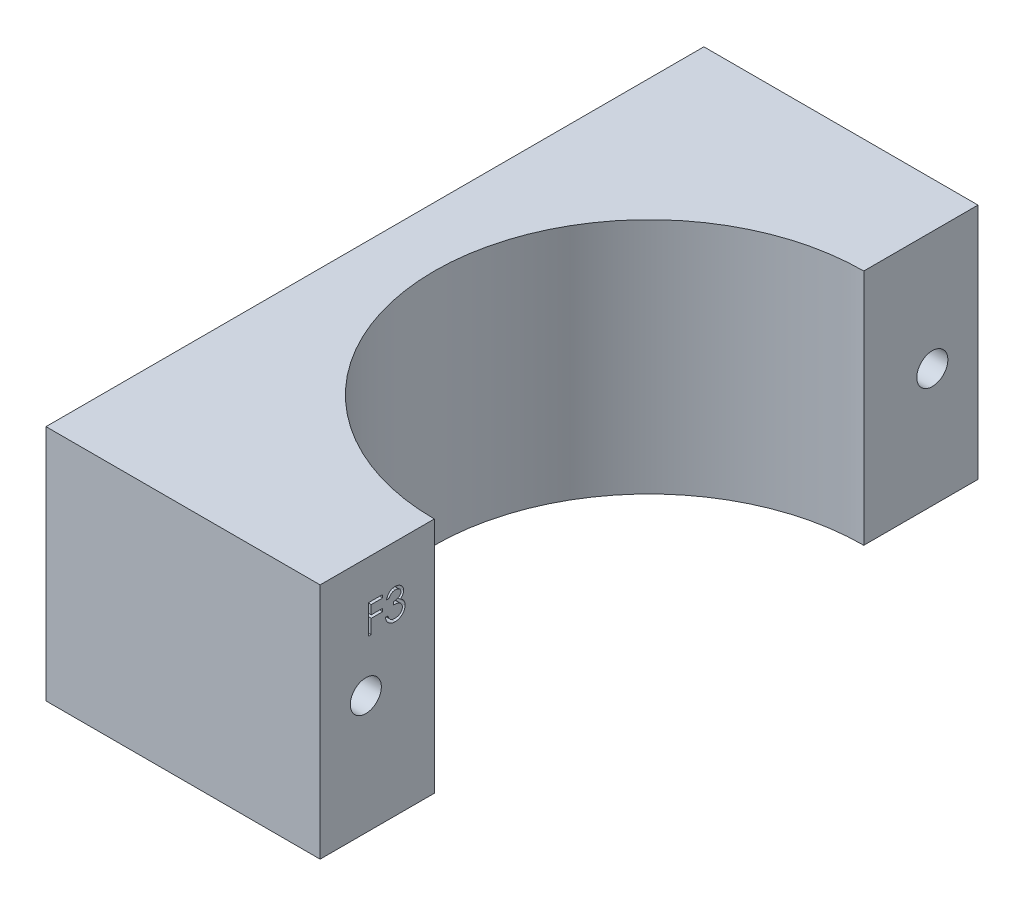
from build123d import *

# Parameters (mm, degrees)
BOSS_EXTRUDE1_DEPTH = 26
SKETCH2_R           = 1.7
CUT_EXTRUDE1_DEPTH  = 56.982083504
CUT_EXTRUDE2_DEPTH  = 1


with BuildPart() as part:
    # Sketch1 → Boss-Extrude1 (new body)
    with BuildSketch(Plane(origin=(0, 0, 0), x_dir=(1, 0, 0), z_dir=(0, 1, 0))):
        with BuildLine():
            Line((-46.998275301, 32.528571429), (-46.998275301, -39.471428571))
            Line((-46.998275301, -39.471428571), (-16.998275301, -39.471428571))
            Line((-16.998275301, -39.471428571), (-16.998275301, -26.971428571))
            ThreePointArc((-16.998275301, -26.971428571), (-40.498275301, -3.471428571), (-16.998275301, 20.028571429))
            Line((-16.998275301, 20.028571429), (-16.998275301, 32.528571429))
            Line((-16.998275301, 32.528571429), (-46.998275301, 32.528571429))
        make_face()
    extrude(amount=BOSS_EXTRUDE1_DEPTH)

    # Sketch2 → Cut-Extrude1 (cut, through all)
    with BuildSketch(Plane(origin=(-16.998275301, 0, 0), x_dir=(0, 0, -1), z_dir=(1, 0, 0))):
        with Locations((-34.471428571, 13)):
            Circle(SKETCH2_R)
        with Locations((27.528571429, 13)):
            Circle(SKETCH2_R)
    extrude(amount=-CUT_EXTRUDE1_DEPTH, mode=Mode.SUBTRACT)

    # Sketch3 → Cut-Extrude2 (cut)
    with BuildSketch(Plane(origin=(-16.998275301, 0, 0), x_dir=(0, 0, -1), z_dir=(1, 0, 0))):
        Polygon((-34.164231178, 21.664809495), (-32.617436306, 21.664809495), (-32.617436306, 21.33916847), (-33.87929528, 21.33916847), (-33.87929528, 20.362245393), (-32.617436306, 20.362245393), (-32.617436306, 20.036604367), (-33.87929528, 20.036604367), (-33.87929528, 18.489809495), (-34.164231178, 18.489809495), align=None)
        with BuildLine():
            Line((-31.925449127, 20.932117188), (-32.210385024, 20.932117188))
            add(Edge.make_bspline(
                [(-32.210385024, 20.932117188), (-32.202665646, 20.964078084), (-32.187574893, 21.026559022), (-32.156099237, 21.115828465), (-32.121809913, 21.200304803), (-32.080635511, 21.278406241), (-32.035723998, 21.351702388), (-31.984268386, 21.418530809), (-31.928642638, 21.480591142), (-31.86711572, 21.535666721), (-31.802591862, 21.585539376), (-31.734161886, 21.628061749), (-31.663202547, 21.664641516), (-31.589222205, 21.694777012), (-31.512000606, 21.717478737), (-31.432235876, 21.733949554), (-31.349718987, 21.744645779), (-31.293705101, 21.745689685), (-31.265262828, 21.746219752)],
                knots=[0, 0, 0, 0, 1.162005537, 2.271625781, 3.343758855, 4.383309926, 5.390229558, 6.379919256, 7.361854164, 8.333198761, 9.295911338, 10.242430842, 11.177959212, 12.116337295, 13.062827104, 14.020064771, 14.994644689, 16, 16, 16, 16], degree=3))
            add(Edge.make_bspline(
                [(-31.265262828, 21.746219752), (-31.223822055, 21.744968593), (-31.141844452, 21.742493567), (-31.021409403, 21.719892614), (-30.905270788, 21.684128386), (-30.794699828, 21.634712934), (-30.691994535, 21.573764443), (-30.600612423, 21.501225003), (-30.521792131, 21.418494208), (-30.455666517, 21.327115382), (-30.403891339, 21.229456455), (-30.365712986, 21.128944884), (-30.342470461, 21.025819096), (-30.339458242, 20.956189278), (-30.337949127, 20.921304888)],
                knots=[0, 0, 0, 0, 1.083050992, 2.142477498, 3.193116406, 4.255571735, 5.30263384, 6.308962982, 7.297363603, 8.282367274, 9.249857812, 10.179914175, 11.08814088, 12, 12, 12, 12], degree=3))
            add(Edge.make_bspline(
                [(-30.337949127, 20.921304888), (-30.33900467, 20.887734439), (-30.341070204, 20.822042278), (-30.358608637, 20.726137777), (-30.388123676, 20.635748611), (-30.429008389, 20.550494272), (-30.481932509, 20.47091531), (-30.546042742, 20.39683268), (-30.621791585, 20.327917801), (-30.679194621, 20.288439422), (-30.708747404, 20.268114784)],
                knots=[0, 0, 0, 0, 1.024540389, 2.004866551, 2.965041327, 3.920577974, 4.882998113, 5.874504559, 6.905732034, 8, 8, 8, 8], degree=3))
            add(Edge.make_bspline(
                [(-30.708747404, 20.268114784), (-30.674972884, 20.251806014), (-30.60805579, 20.219493624), (-30.516842096, 20.156124472), (-30.434040023, 20.082957643), (-30.387863078, 20.025859665), (-30.364661867, 19.997171274)],
                knots=[0, 0, 0, 0, 1.015518401, 2.012035669, 3.001164323, 4, 4, 4, 4], degree=3))
            add(Edge.make_bspline(
                [(-30.364661867, 19.997171274), (-30.349384363, 19.9762546), (-30.319079536, 19.934763775), (-30.281673016, 19.868055732), (-30.247737606, 19.800608309), (-30.221294192, 19.730613705), (-30.20081647, 19.658883186), (-30.186178784, 19.585293584), (-30.177085456, 19.509784806), (-30.175783205, 19.458701342), (-30.175128614, 19.433023638)],
                knots=[0, 0, 0, 0, 1.025084078, 2.033381695, 3.024893161, 4.013698104, 4.991890475, 5.976764909, 6.982997093, 8, 8, 8, 8], degree=3))
            add(Edge.make_bspline(
                [(-30.175128614, 19.433023638), (-30.176756494, 19.38856482), (-30.180004593, 19.299856406), (-30.209036861, 19.168797195), (-30.254043158, 19.040685489), (-30.317957664, 18.918153313), (-30.395851761, 18.803508253), (-30.488523048, 18.700931887), (-30.594918576, 18.612758868), (-30.713577986, 18.539089589), (-30.842135666, 18.48019976), (-30.979636382, 18.439326223), (-31.124098931, 18.412705209), (-31.223165551, 18.409850549), (-31.273531058, 18.408399239)],
                knots=[0, 0, 0, 0, 0.955779014, 1.907060117, 2.875433937, 3.871313158, 4.872415639, 5.851225146, 6.836215519, 7.83643374, 8.849228613, 9.86973379, 10.916971861, 12, 12, 12, 12], degree=3))
            add(Edge.make_bspline(
                [(-31.273531058, 18.408399239), (-31.307475709, 18.409186832), (-31.374267462, 18.410736554), (-31.472459779, 18.421330713), (-31.56618732, 18.440680075), (-31.655576813, 18.466718074), (-31.740707667, 18.499730583), (-31.821320105, 18.540841116), (-31.89791008, 18.589202264), (-31.969754843, 18.645384876), (-32.03684583, 18.708232948), (-32.097400087, 18.778862193), (-32.152427184, 18.855966981), (-32.200453721, 18.940442896), (-32.243667242, 19.031198237), (-32.279209967, 19.129395089), (-32.310493304, 19.234155595), (-32.325037947, 19.307160402), (-32.332500409, 19.344617188)],
                knots=[0, 0, 0, 0, 1.048658725, 2.063410685, 3.046034179, 4.001477787, 4.936774919, 5.862367409, 6.792675028, 7.730719943, 8.675894397, 9.627829632, 10.600096036, 11.597688215, 12.626045268, 13.701542398, 14.82072376, 16, 16, 16, 16], degree=3))
            Line((-32.332500409, 19.344617188), (-32.047564511, 19.344617188))
            add(Edge.make_bspline(
                [(-32.047564511, 19.344617188), (-32.040141097, 19.320170583), (-32.025701911, 19.272619813), (-32.001123512, 19.204184678), (-31.97312158, 19.141448444), (-31.943081944, 19.083950898), (-31.911532925, 19.03112579), (-31.876231529, 18.984369952), (-31.839792376, 18.941629733), (-31.812324677, 18.917549977), (-31.798881619, 18.905765024)],
                knots=[0, 0, 0, 0, 1.198163088, 2.33053128, 3.407730985, 4.417276592, 5.372219308, 6.28897303, 7.162600585, 8, 8, 8, 8], degree=3))
            add(Edge.make_bspline(
                [(-31.798881619, 18.905765024), (-31.781104724, 18.892059607), (-31.745605808, 18.864691078), (-31.687758913, 18.829764601), (-31.626921481, 18.799501385), (-31.561775312, 18.776384033), (-31.493726199, 18.756810012), (-31.421674232, 18.744000684), (-31.346255085, 18.735212128), (-31.294758614, 18.734436583), (-31.268442917, 18.734040265)],
                knots=[0, 0, 0, 0, 0.946170439, 1.889420265, 2.845303464, 3.807233317, 4.801018734, 5.828864929, 6.890507805, 8, 8, 8, 8], degree=3))
            add(Edge.make_bspline(
                [(-31.268442917, 18.734040265), (-31.238730811, 18.734598979), (-31.180631352, 18.735691496), (-31.095854444, 18.745738744), (-31.015202688, 18.760371333), (-30.939571534, 18.782970968), (-30.867970288, 18.810893597), (-30.801402649, 18.845953222), (-30.738994753, 18.887087363), (-30.681545935, 18.933840742), (-30.629888224, 18.985023099), (-30.584404523, 19.038556384), (-30.545737866, 19.094214887), (-30.514547049, 19.152306611), (-30.489917621, 19.212590997), (-30.473150717, 19.275237221), (-30.461492557, 19.339732598), (-30.46054313, 19.383573877), (-30.460064511, 19.40567488)],
                knots=[0, 0, 0, 0, 1.217147791, 2.380027433, 3.494444702, 4.572153297, 5.609568379, 6.639424714, 7.649109417, 8.668170816, 9.669597737, 10.625200337, 11.543417969, 12.441394052, 13.322311151, 14.205496177, 15.095365482, 16, 16, 16, 16], degree=3))
            add(Edge.make_bspline(
                [(-30.460064511, 19.40567488), (-30.461452713, 19.435258023), (-30.46422221, 19.494277108), (-30.485366421, 19.581106622), (-30.520145248, 19.664766431), (-30.568833883, 19.743829184), (-30.628102723, 19.817104466), (-30.697376603, 19.882483596), (-30.777230781, 19.936431465), (-30.850727377, 19.973704746), (-30.915828626, 19.999138378), (-30.971541153, 20.016079239), (-31.033913215, 20.030424484), (-31.102190546, 20.043770616), (-31.176887606, 20.055129267), (-31.257923075, 20.064601486), (-31.345313373, 20.072180702), (-31.405811788, 20.075565338), (-31.436987588, 20.077309495)],
                knots=[0, 0, 0, 0, 1.07054697, 2.135767047, 3.216561865, 4.33974944, 5.486079747, 6.621378074, 7.775625952, 8.963672916, 9.598146892, 10.304877434, 11.070270905, 11.915000392, 12.823868403, 13.805723172, 14.86925407, 16, 16, 16, 16], degree=3))
            Line((-31.436987588, 20.077309495), (-31.436987588, 20.402950521))
            add(Edge.make_bspline(
                [(-31.436987588, 20.402950521), (-31.397707245, 20.403617093), (-31.320766702, 20.404922744), (-31.208376868, 20.420714296), (-31.100904649, 20.442558866), (-31.000731819, 20.476019004), (-30.909429058, 20.514881274), (-30.830217704, 20.560104349), (-30.764207507, 20.610373443), (-30.711719249, 20.666464453), (-30.67223202, 20.726621675), (-30.643360568, 20.789320357), (-30.626305986, 20.855110041), (-30.62402936, 20.900008776), (-30.622885024, 20.922576923)],
                knots=[0, 0, 0, 0, 1.321986639, 2.589447074, 3.816329219, 5.01088745, 6.139805852, 7.153945165, 8.075214402, 8.924034688, 9.728124013, 10.488707548, 11.240355623, 12, 12, 12, 12], degree=3))
            add(Edge.make_bspline(
                [(-30.622885024, 20.922576923), (-30.623260954, 20.939157449), (-30.624008849, 20.972143619), (-30.633440665, 21.020335646), (-30.647613902, 21.067054361), (-30.667099085, 21.112101089), (-30.693179623, 21.155163409), (-30.724390767, 21.196608452), (-30.761554687, 21.236199594), (-30.804140914, 21.273102455), (-30.849871623, 21.308271692), (-30.899991062, 21.338129063), (-30.952988048, 21.363660655), (-31.008921256, 21.384714989), (-31.067972202, 21.400553057), (-31.129863436, 21.411924856), (-31.194712977, 21.419034729), (-31.238955906, 21.420058363), (-31.261446723, 21.420578726)],
                knots=[0, 0, 0, 0, 0.884392785, 1.759457502, 2.611959086, 3.489218968, 4.37281399, 5.2945488, 6.255912374, 7.266815255, 8.301784654, 9.332968512, 10.37626691, 11.440494194, 12.520033166, 13.637162961, 14.798855837, 16, 16, 16, 16], degree=3))
            add(Edge.make_bspline(
                [(-31.261446723, 21.420578726), (-31.297597879, 21.419316562), (-31.368209494, 21.416851262), (-31.470004455, 21.395258528), (-31.564636993, 21.360806981), (-31.636971355, 21.319683456), (-31.690386262, 21.27908842), (-31.728556056, 21.243635112), (-31.766039662, 21.204235337), (-31.800371097, 21.158462382), (-31.835091062, 21.109416079), (-31.866700057, 21.054603168), (-31.897415635, 20.995453468), (-31.915923662, 20.953638142), (-31.925449127, 20.932117188)],
                knots=[0, 0, 0, 0, 1.472543308, 2.876219568, 4.221790263, 5.565193594, 6.249813518, 6.953379497, 7.687249741, 8.463570142, 9.283606569, 10.136032583, 11.040678096, 12, 12, 12, 12], degree=3))
        make_face()
    extrude(amount=-CUT_EXTRUDE2_DEPTH, mode=Mode.SUBTRACT)


solid = part.part
